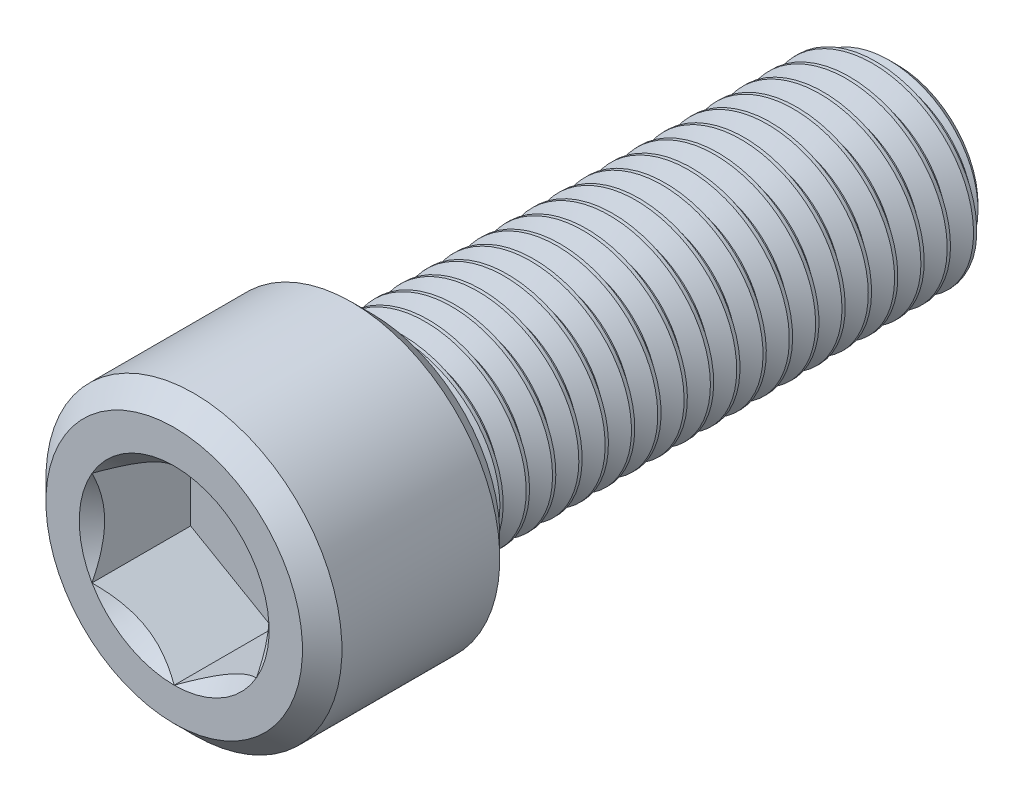
from build123d import *

# Parameters (mm, degrees)
CUT_EXTRUDE1_DEPTH = 9.525
CUT_SWEEP1_PITCH   = 2.54
CUT_SWEEP1_TO      = 50.8


with BuildPart() as part:
    # Sketch3 → Revolve1 (revolve)
    with BuildSketch(Plane(origin=(0, 0, 0), x_dir=(0, 0, -1), z_dir=(1, 0, 0))):
        Polygon((34.925, 0), (-34.925, 0), (-34.925, 12.3825), (-33.02, 14.2875), (-17.78, 14.2875), (-15.875, 12.3825), (-15.875, 9.525), (33.147, 9.525), (34.925, 7.747), align=None)
    revolve(axis=Axis((0, 0, -34.925), (0, 0, 1)))

    # Sketch4 → Cut-Extrude1 (cut)
    with BuildSketch(Plane.XY.offset(34.925)):
        Polygon((0, -9.165435523), (7.9375, -4.582717762), (7.9375, 4.582717762), (0, 9.165435523), (-7.9375, 4.582717762), (-7.9375, -4.582717762), align=None)
    extrude(amount=-CUT_EXTRUDE1_DEPTH, mode=Mode.SUBTRACT)

    # Cut-Extrude3 cone 1 section (through the dimple's axis) → Cut-Extrude3 (revolve, cut)
    with BuildSketch(Plane(origin=(0, 0, 34.925), x_dir=(0, -1, 0), z_dir=(1, 0, 0))):
        Polygon((0, 0), (9.165435523, 0), (0, 9.165435523), align=None)
    revolve(axis=Axis((0, 0, 34.925), (0, 0, -1)), mode=Mode.SUBTRACT)


with BuildPart() as body_2:
    # Split1: read off the stored shape, not the designer's step
    # Split1: the piece on the far side of the plane
    add(part.part)
    split(bisect_by=Plane.XY.offset(15.875), keep=Keep.BOTTOM)

    # Cut-Sweep1: arcs per turn and ends read off the stored shape
    # Cut-Sweep1: the profile of Sketch7 screwed along a right-hand helix through 21 turns, 10 arcs to a turn; built about Z, then put on its axis
    cut_sweep1_z = Axis((0, 0, 0), (0, 0, 1))
    cut_sweep1_corners = [(9.662481533, 0, 0.079375), (9.662481533, 0, -2.301875), (7.875221606, 0, -1.27), (7.875221606, 0, -0.9525)]
    with BuildLine(mode=Mode.PRIVATE) as cut_sweep1_profile:
        Line(cut_sweep1_corners[0], cut_sweep1_corners[1])
        Line(cut_sweep1_corners[1], cut_sweep1_corners[2])
        Line(cut_sweep1_corners[2], cut_sweep1_corners[3])
        Line(cut_sweep1_corners[3], cut_sweep1_corners[0])
    cut_sweep1_cap = Face(cut_sweep1_profile.wire())
    cut_sweep1_turn_angles = [0, 18, 36, 54, 72, 90, 108, 126, 144, 162, 180, 198, 216, 234, 252, 270, 288, 306, 324, 342, 360]
    cut_sweep1_turn_weights = [1, 0.9510565162951535, 1, 0.9510565162951535, 1, 0.9510565162951535, 1, 0.9510565162951535, 1, 0.9510565162951535, 1, 0.9510565162951535, 1, 0.9510565162951535, 1, 0.9510565162951535, 1, 0.9510565162951535, 1, 0.9510565162951535, 1]
    cut_sweep1_turn_rails = [Edge.make_bspline([Vector(p[0], p[1], 0).rotate(cut_sweep1_z, cut_sweep1_turn_angles[k]) / cut_sweep1_turn_weights[k] + Vector(0, 0, p[2] + CUT_SWEEP1_PITCH * cut_sweep1_turn_angles[k] / 360) for k in range(21)], [0, 0, 0, 1, 1, 2, 2, 3, 3, 4, 4, 5, 5, 6, 6, 7, 7, 8, 8, 9, 9, 10, 10, 10], 2, cut_sweep1_turn_weights) for p in cut_sweep1_corners]
    cut_sweep1_turn_sides = [Face.make_surface_from_curves(cut_sweep1_turn_rails[p[0]], cut_sweep1_turn_rails[p[1]]) for p in [(0, 1), (1, 2), (2, 3), (3, 0)]]
    cut_sweep1 = Plane(origin=(0, 0, -34.925), x_dir=(0, 1, 0), z_dir=(0, 0, 1)) * split(Solid(Shell([*[p.moved(Location((0, 0, CUT_SWEEP1_PITCH * i))) for i in range(21) for p in cut_sweep1_turn_sides], cut_sweep1_cap, cut_sweep1_cap.rotate(cut_sweep1_z, 7560).moved(Location((0, 0, CUT_SWEEP1_PITCH * 7560 / 360)))])), bisect_by=Plane.XY.offset(CUT_SWEEP1_TO), keep=Keep.BOTTOM, mode=Mode.PRIVATE)
    add(cut_sweep1, mode=Mode.SUBTRACT)


with BuildPart() as part_1:
    add(part.part)

    # Split1
    split(bisect_by=Plane.XY.offset(15.875), keep=Keep.TOP)

    add(body_2.part)  # Boss-Extrude1 merges body 2
    # Boss-Extrude1: read off the stored shape, not the designer's step
    # Boss-Extrude1 outline → Boss-Extrude1 (revolve)
    with BuildSketch(Plane.XZ):
        Polygon((7.875212643, 15.875), (7.875212643, 15.584097977), (9.525, 15.875), align=None)
    revolve(axis=Axis((0, 0, 0), (0, 0, 1)))


solid = part_1.part
